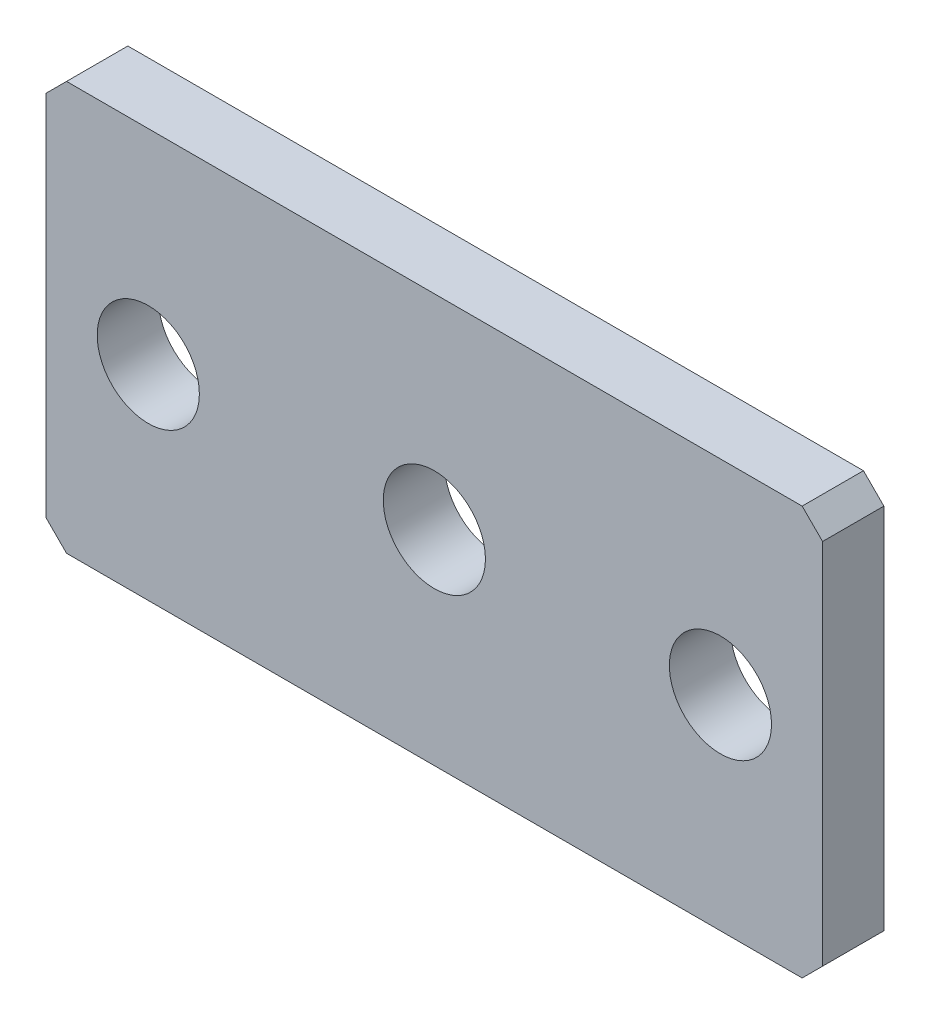
from build123d import *

# Parameters (mm, degrees)
SKETCH_1_R             = 2.5
SM_BASE_FLANGE_1_DEPTH = 3
HOLE_WIZARD_M6_1_D     = 5
HOLE_WIZARD_M6_1_DEPTH = 19
HOLE_WIZARD_M6_1_TIP   = 1.502151548


# Sheet-metal steps are written as plain solids
with BuildPart() as part:
    # Sketch 1 → 基体-法兰1 (new body)
    with BuildSketch(Plane.XY):
        Polygon((-18, 10), (18, 10), (19, 9), (19, -9), (18, -10), (-18, -10), (-19, -9), (-19, 9), align=None)
        with Locations((-14, 0)):
            Circle(SKETCH_1_R, mode=Mode.SUBTRACT)
        with Locations((14, 0)):
            Circle(SKETCH_1_R, mode=Mode.SUBTRACT)
    extrude(amount=-SM_BASE_FLANGE_1_DEPTH)

    # M6 螺纹孔1
    with Locations(Plane.XY):
        with Locations((0, 0)):
            Hole(HOLE_WIZARD_M6_1_D / 2, depth=HOLE_WIZARD_M6_1_DEPTH)
            with Locations((0, 0, -(HOLE_WIZARD_M6_1_DEPTH + HOLE_WIZARD_M6_1_TIP / 2))):  # 118° drill point
                Cone(0, HOLE_WIZARD_M6_1_D / 2, HOLE_WIZARD_M6_1_TIP, mode=Mode.SUBTRACT)


solid = part.part
